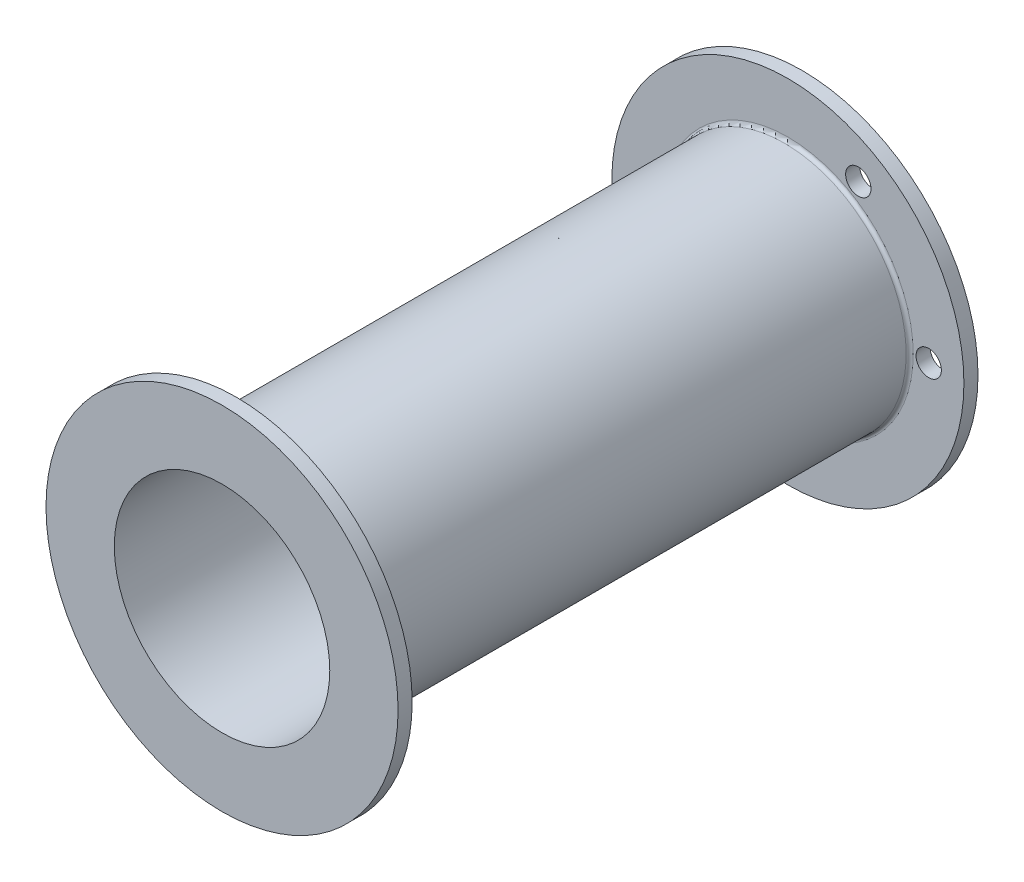
from build123d import *
from build123d.topology import SkipClean

# Parameters (mm, degrees)
SKETCH1_R           = 8.65
SKETCH1_R_2         = 7.65
BOSS_EXTRUDE1_DEPTH = 40.18
BOSS_EXTRUDE2_START = 1
SKETCH2_R           = 12.5
SKETCH2_R_2         = 7.65
BOSS_EXTRUDE2_DEPTH = 1
CIRPATTERN1_COUNT   = 6
FILLET1_R           = 0.25


with BuildPart() as part:
    # Sketch1 → Boss-Extrude1 (new body)
    with BuildSketch(Plane.XY):
        Circle(SKETCH1_R)
        Circle(SKETCH1_R_2, mode=Mode.SUBTRACT)
    extrude(amount=BOSS_EXTRUDE1_DEPTH)

    # Sketch2 → Boss-Extrude2 (add)
    with SkipClean():  # the faces are left unmerged after this step: merging them gives an invalid solid
        with BuildSketch(Plane(origin=(0, 0, 0), x_dir=(-1, 0, 0), z_dir=(0, 0, -1)).offset(BOSS_EXTRUDE2_START)):
            Circle(SKETCH2_R)
            Circle(SKETCH2_R_2, mode=Mode.SUBTRACT)
        boss_extrude2 = extrude(amount=-BOSS_EXTRUDE2_DEPTH)

    # Sketch11 → M1.6 Clearance Hole1 (revolve, cut)
    with SkipClean():  # the faces are left unmerged after this step: merging them gives an invalid solid
        with BuildSketch(Plane(origin=(-10, 0, 0), x_dir=(0, -1, 0), z_dir=(1, 0, 0))):
            Polygon((0, 0), (0, 5.540774557), (0.9, 5), (0.9, 0), align=None)
        m1_6_clearance_hole1 = revolve(axis=Axis((-10, 0, 6.35), (0, 0, -1)), mode=Mode.SUBTRACT)

    # CirPattern1: M1.6 Clearance Hole1 ×6 about axis, 2 skipped
    with SkipClean():  # the faces are left unmerged after this step: merging them gives an invalid solid
        cirpattern1_axis = Axis((0, 0, 0), (0, 0, -1))
        add([m1_6_clearance_hole1.rotate(cirpattern1_axis, i * 360 / CIRPATTERN1_COUNT) for i in range(1, CIRPATTERN1_COUNT) if i not in (1, 4)], mode=Mode.SUBTRACT)

    # Fillet1
    fillet1_edges = [part.edges().sort_by_distance(p)[0] for p in [
        (-8.65, 0, 0),
    ]]
    fillet(fillet1_edges, radius=FILLET1_R)

    # Mirror1: Boss-Extrude2 across plane
    add(boss_extrude2.mirror(Plane.XY.offset(19.59)))


solid = part.part
